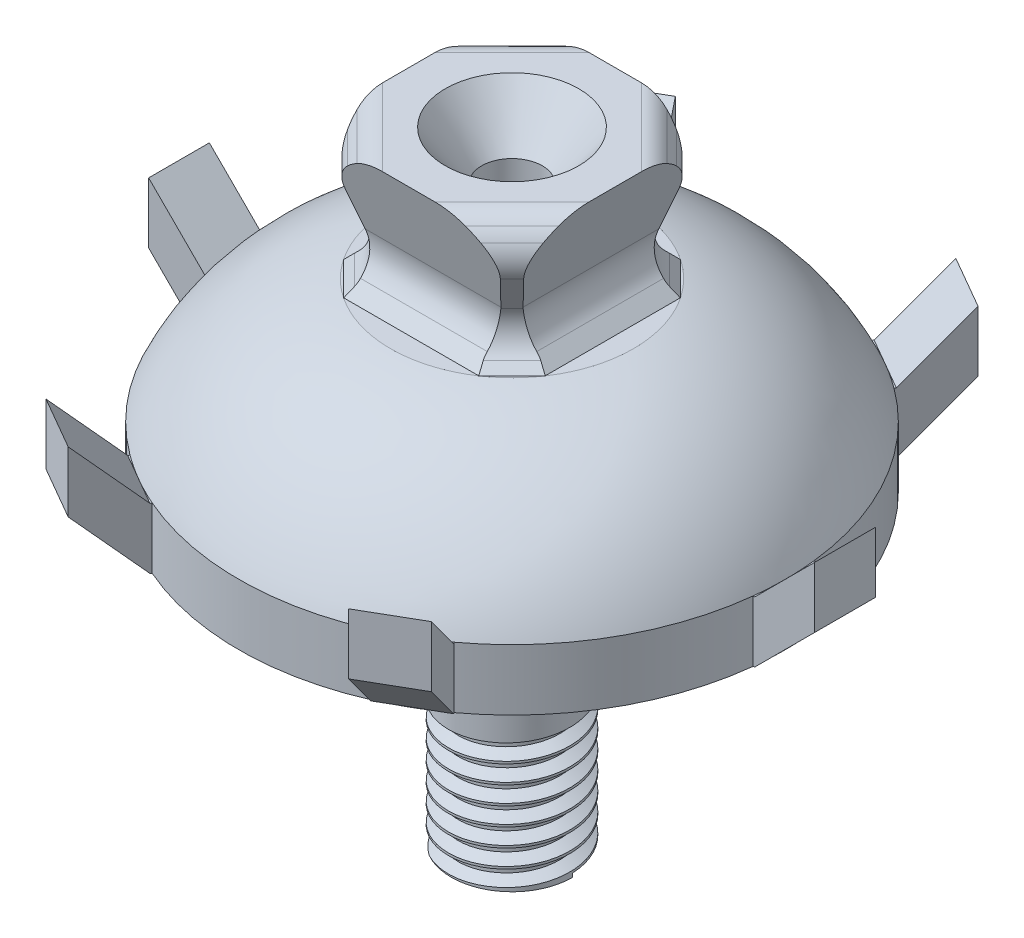
from build123d import *

# Parameters (mm, degrees)
SKETCH4_W           = 17
SKETCH4_H           = 11
BOSS_EXTRUDE2_DEPTH = 8.5
CUT_EXTRUDE1_DEPTH  = 13.5
CUT_EXTRUDE2_DEPTH  = 13.5
CUT_EXTRUDE3_DEPTH  = 13.5
CUT_EXTRUDE4_DEPTH  = 13.5
FILLET1_R           = 2
THREAD1_PITCH       = 1.5
BOSS_EXTRUDE3_DEPTH = 2.5
CIRPATTERN1_COUNT   = 6


with BuildPart() as part:
    # Sketch4 → Boss-Extrude2 (new, symmetric)
    with BuildSketch(Plane.XY):
        Rectangle(SKETCH4_W, SKETCH4_H)
    extrude(amount=BOSS_EXTRUDE2_DEPTH, both=True)

    # Sketch5 → Cut-Extrude1 (cut, symmetric)
    with BuildSketch(Plane(origin=(0, 0, 0), x_dir=(0, 0, -1), z_dir=(1, 0, 0))):
        with BuildLine():
            Line((8.5, 5.5), (6.502509808, -1.291466653))
            ThreePointArc((6.502509808, -1.291466653), (6.473626767, -2.879228009), (7.259285969, -4.259285969))
            Line((7.259285969, -4.259285969), (8.5, -5.5))
            Line((8.5, -5.5), (8.5, 5.5))
        make_face()
        with BuildLine():
            Line((-8.5, -5.5), (-7.259285969, -4.259285969))
            ThreePointArc((-7.259285969, -4.259285969), (-6.473626767, -2.879228009), (-6.502509808, -1.291466653))
            Line((-6.502509808, -1.291466653), (-8.5, 5.5))
            Line((-8.5, 5.5), (-8.5, -5.5))
        make_face()
    extrude(amount=CUT_EXTRUDE1_DEPTH, both=True, mode=Mode.SUBTRACT)

    # Sketch7 → Cut-Extrude2 (cut, symmetric)
    with BuildSketch(Plane.XY):
        with BuildLine():
            Line((8.5, 5.5), (6.502538332, -1.291517059))
            ThreePointArc((6.502538332, -1.291517059), (6.473662442, -2.879270046), (7.259319467, -4.259319467))
            Line((7.259319467, -4.259319467), (8.5, -5.5))
            Line((8.5, -5.5), (8.5, 5.5))
        make_face()
        with BuildLine():
            Line((-8.5, -5.5), (-7.259319467, -4.259319467))
            ThreePointArc((-7.259319467, -4.259319467), (-6.473662442, -2.879270046), (-6.502538332, -1.291517059))
            Line((-6.502538332, -1.291517059), (-8.5, 5.5))
            Line((-8.5, 5.5), (-8.5, -5.5))
        make_face()
    extrude(amount=CUT_EXTRUDE2_DEPTH, both=True, mode=Mode.SUBTRACT)

    # Sketch11 → Cut-Extrude3 (cut, symmetric)
    with BuildSketch(Plane(origin=(0, 0, 0), x_dir=(0.7071067811865509, 0, -0.7071067811865441), z_dir=(0.7071067811865441, 0, 0.7071067811865509))):
        with BuildLine():
            Line((10, -5.5), (9.159523089, -4.659523089))
            ThreePointArc((9.159523089, -4.659523089), (8.341069319, -3.136306549), (8.499291869, -1.414382965))
            Line((8.499291869, -1.414382965), (9.693462893, 1.541294037))
            ThreePointArc((9.693462893, 1.541294037), (9.908907559, 2.799328578), (9.581873492, 4.033069244))
            ThreePointArc((9.581873492, 4.033069244), (9.013209006, 4.854851227), (8.25, 5.5))
            Line((8.25, 5.5), (14, 5.5))
            Line((14, 5.5), (14, -5.5))
            Line((14, -5.5), (10, -5.5))
        make_face()
        with BuildLine():
            Line((-14, 5.5), (-8.25, 5.5))
            ThreePointArc((-8.25, 5.5), (-9.013209006, 4.854851227), (-9.581873492, 4.033069244))
            ThreePointArc((-9.581873492, 4.033069244), (-9.908907559, 2.799328578), (-9.693462893, 1.541294037))
            Line((-9.693462893, 1.541294037), (-8.499291869, -1.414382965))
            ThreePointArc((-8.499291869, -1.414382965), (-8.341069319, -3.136306549), (-9.159523089, -4.659523089))
            Line((-9.159523089, -4.659523089), (-10, -5.5))
            Line((-10, -5.5), (-14, -5.5))
            Line((-14, -5.5), (-14, 5.5))
        make_face()
    extrude(amount=CUT_EXTRUDE3_DEPTH, both=True, mode=Mode.SUBTRACT)

    # Sketch12 → Cut-Extrude4 (cut, symmetric)
    with BuildSketch(Plane(origin=(0, 0, 0), x_dir=(-0.7071067811865465, 0, -0.7071067811865486), z_dir=(0.7071067811865486, 0, -0.7071067811865465))):
        with BuildLine():
            Line((10, -5.5), (9.159523089, -4.659523089))
            ThreePointArc((9.159523089, -4.659523089), (8.341069319, -3.136306549), (8.499291869, -1.414382965))
            Line((8.499291869, -1.414382965), (9.693462893, 1.541294037))
            ThreePointArc((9.693462893, 1.541294037), (9.908907559, 2.799328578), (9.581873492, 4.033069244))
            ThreePointArc((9.581873492, 4.033069244), (9.013209006, 4.854851227), (8.25, 5.5))
            Line((8.25, 5.5), (14, 5.5))
            Line((14, 5.5), (14, -5.5))
            Line((14, -5.5), (10, -5.5))
        make_face()
        with BuildLine():
            Line((-14, 5.5), (-8.25, 5.5))
            ThreePointArc((-8.25, 5.5), (-9.013209006, 4.854851227), (-9.581873492, 4.033069244))
            ThreePointArc((-9.581873492, 4.033069244), (-9.908907559, 2.799328578), (-9.693462893, 1.541294037))
            Line((-9.693462893, 1.541294037), (-8.499291869, -1.414382965))
            ThreePointArc((-8.499291869, -1.414382965), (-8.341069319, -3.136306549), (-9.159523089, -4.659523089))
            Line((-9.159523089, -4.659523089), (-10, -5.5))
            Line((-10, -5.5), (-14, -5.5))
            Line((-14, -5.5), (-14, 5.5))
        make_face()
    extrude(amount=CUT_EXTRUDE4_DEPTH, both=True, mode=Mode.SUBTRACT)

    # Sketch14 → Cut-Revolve1 (revolve, cut)
    with BuildSketch(Plane.XY, mode=Mode.PRIVATE) as cut_revolve1_sk:
        Polygon((0, 5.5), (5.5, 5.5), (2.5, 1.5), (2.5, -5.5), (0, -5.5), align=None)
    revolve(cut_revolve1_sk.sketch.rotate(Axis((0, -5.5, 0), (0, 1, 0)), 90), axis=Axis((0, -5.5, 0), (0, 1, 0)), mode=Mode.SUBTRACT)

    # Fillet1
    fillet1_edges = [part.edges().sort_by_distance(p)[0] for p in [
        (5.833630945, 5.5, -5.833630945),
        (-5.833630945, 5.5, -5.833630945),
        (-5.833630945, 5.5, 5.833630945),
        (5.833630945, 5.5, 5.833630945),
    ]]
    fillet(fillet1_edges, radius=FILLET1_R)

    # Sketch15 → Revolve1 (revolve)
    with BuildSketch(Plane(origin=(0, 0, 0), x_dir=(0, 0, -1), z_dir=(1, 0, 0))):
        with BuildLine():
            Line((0, -45.5), (0, -5.5))
            Line((0, -5.5), (0, -5.3))
            Line((0, -5.3), (9.9979998, -5.3))
            ThreePointArc((9.9979998, -5.3), (17.455904629, -8.920713416), (22.5, -15.5))
            Line((22.5, -15.5), (22.5, -20.524094811))
            Line((22.5, -20.524094811), (5, -25.904076163))
            Line((5, -25.904076163), (5, -45.5))
            Line((5, -45.5), (0, -45.5))
        make_face()
    revolve(axis=Axis((0, -45.5, 0), (0, 1, 0)))

    # Thread1: the profile of Thread Profile3 profile screwed along a right-hand helix of 7.333333 turns, 8 arcs to a turn; built about Z, then put on its axis
    thread1_z = Axis((0, 0, 0), (0, 0, 1))
    thread1_corners = [(5.0003, 0, -0.000173205), (5.0003, 0, 1.312673201), (4.188101188, 0, 0.843749998), (4.188101188, 0, 0.468749998)]
    with BuildLine(mode=Mode.PRIVATE) as thread1_profile:
        Line(thread1_corners[0], thread1_corners[1])
        Line(thread1_corners[1], thread1_corners[2])
        Line(thread1_corners[2], thread1_corners[3])
        Line(thread1_corners[3], thread1_corners[0])
    thread1_cap = Face(thread1_profile.wire())
    thread1_turn_angles = [0, 22.5, 45, 67.5, 90, 112.5, 135, 157.5, 180, 202.5, 225, 247.5, 270, 292.5, 315, 337.5, 360]
    thread1_turn_weights = [1, 0.9238795325112867, 1, 0.9238795325112867, 1, 0.9238795325112867, 1, 0.9238795325112867, 1, 0.9238795325112867, 1, 0.9238795325112867, 1, 0.9238795325112867, 1, 0.9238795325112867, 1]
    thread1_turn_rails = [Edge.make_bspline([Vector(p[0], p[1], 0).rotate(thread1_z, thread1_turn_angles[k]) / thread1_turn_weights[k] + Vector(0, 0, p[2] + THREAD1_PITCH * thread1_turn_angles[k] / 360) for k in range(17)], [0, 0, 0, 1, 1, 2, 2, 3, 3, 4, 4, 5, 5, 6, 6, 7, 7, 8, 8, 8], 2, thread1_turn_weights) for p in thread1_corners]
    thread1_turn_sides = [Face.make_surface_from_curves(thread1_turn_rails[p[0]], thread1_turn_rails[p[1]]) for p in [(0, 1), (1, 2), (2, 3), (3, 0)]]
    thread1_last_angles = [2520, 2542.5, 2565, 2587.5, 2610, 2625, 2640]
    thread1_last_weights = [1, 0.9238795325112867, 1, 0.9238795325112867, 1, 0.9659258262890693, 1]
    thread1_last_rails = [Edge.make_bspline([Vector(p[0], p[1], 0).rotate(thread1_z, thread1_last_angles[k]) / thread1_last_weights[k] + Vector(0, 0, p[2] + THREAD1_PITCH * thread1_last_angles[k] / 360) for k in range(7)], [0, 0, 0, 1, 1, 2, 2, 3, 3, 3], 2, thread1_last_weights) for p in thread1_corners]
    thread1_last_sides = [Face.make_surface_from_curves(thread1_last_rails[p[0]], thread1_last_rails[p[1]]) for p in [(0, 1), (1, 2), (2, 3), (3, 0)]]
    thread1 = Plane(origin=(0, -46.5, 0), x_dir=(1, 0, 0), z_dir=(0, 1, 0)) * Solid(Shell([*[p.moved(Location((0, 0, THREAD1_PITCH * i))) for i in range(7) for p in thread1_turn_sides], *thread1_last_sides, thread1_cap, thread1_cap.rotate(thread1_z, 2640).moved(Location((0, 0, THREAD1_PITCH * 2640 / 360)))]))
    add(thread1, mode=Mode.SUBTRACT)

    # Sketch16 → Boss-Extrude3 (add, symmetric)
    with BuildSketch(Plane.XY):
        Polygon((22.5, -15.5), (27.425652657, -10.574347343), (27.425652657, -15.574347343), (22.475905189, -20.524094811), (16.5, -20.524094811), (16.5, -15.5), align=None)
    boss_extrude3 = extrude(amount=BOSS_EXTRUDE3_DEPTH, both=True)

    # CirPattern1: Boss-Extrude3 ×6 about axis
    cirpattern1_axis = Axis((0, 0, 0), (0, 1, 0))
    for i in range(1, CIRPATTERN1_COUNT):
        add(boss_extrude3.rotate(cirpattern1_axis, i * 360 / CIRPATTERN1_COUNT))


solid = part.part
